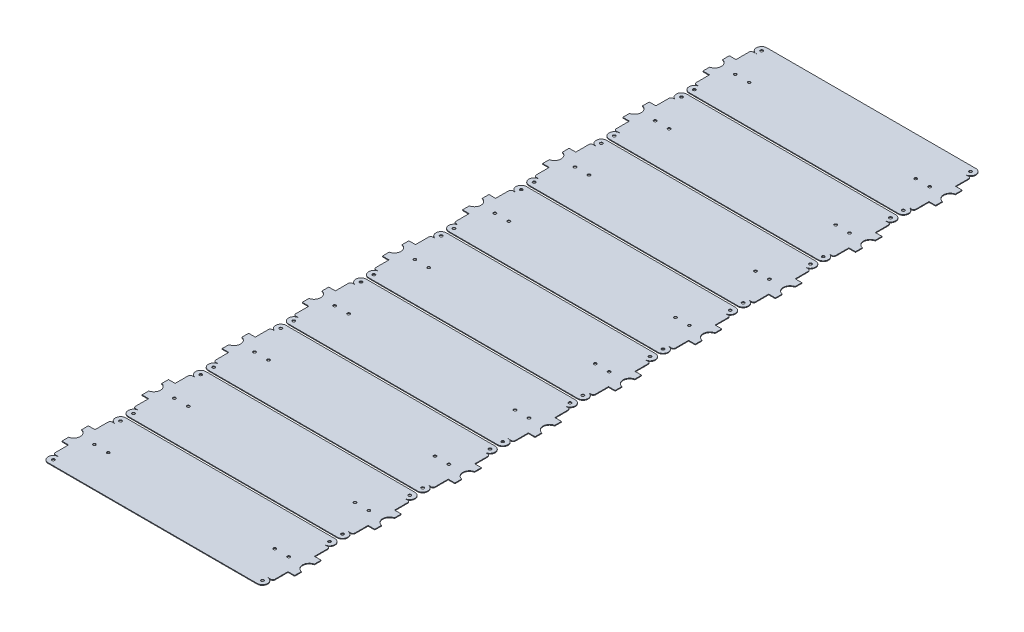
from build123d import *

# Parameters (mm, degrees)
SKETCH1_R           = 2
BOSS_EXTRUDE1_DEPTH = 1
LPATTERN1_COUNT     = 9
LPATTERN1_PITCH     = 115


with BuildPart() as part:
    # Sketch1 → Boss-Extrude1 (new body)
    with BuildSketch(Plane(origin=(0, 0, 0), x_dir=(1, 0, 0), z_dir=(0, 1, 0))):
        with BuildLine():
            ThreePointArc((150, 40.75), (157.5, 48.25), (150, 55.75))
            Line((150, 55.75), (-150, 55.75))
            ThreePointArc((-150, 55.75), (-157.5, 48.25), (-150, 40.75))
            Line((-150, 40.75), (-154.5, 40.75))
            ThreePointArc((-154.5, 40.75), (-156.621320344, 39.871320344), (-157.5, 37.75))
            Line((-157.5, 37.75), (-157.5, 19))
            Line((-157.5, 19), (-167.025, 19))
            Line((-167.025, 19), (-167.025, 9.312659395))
            ThreePointArc((-167.025, 9.312659395), (-159.5, 0), (-167.025, -9.312659395))
            Line((-167.025, -9.312659395), (-167.025, -19))
            Line((-167.025, -19), (-157.5, -19))
            Line((-157.5, -19), (-157.5, -37.75))
            ThreePointArc((-157.5, -37.75), (-156.621320344, -39.871320344), (-154.5, -40.75))
            Line((-154.5, -40.75), (-150, -40.75))
            ThreePointArc((-150, -40.75), (-157.5, -48.25), (-150, -55.75))
            Line((-150, -55.75), (150, -55.75))
            ThreePointArc((150, -55.75), (157.5, -48.25), (150, -40.75))
            Line((150, -40.75), (154.5, -40.75))
            ThreePointArc((154.5, -40.75), (156.621320344, -39.871320344), (157.5, -37.75))
            Line((157.5, -37.75), (157.5, -19))
            Line((157.5, -19), (167.025, -19))
            Line((167.025, -19), (167.025, -9.312659395))
            ThreePointArc((167.025, -9.312659395), (159.5, 0), (167.025, 9.312659395))
            Line((167.025, 9.312659395), (167.025, 19))
            Line((167.025, 19), (157.5, 19))
            Line((157.5, 19), (157.5, 37.75))
            ThreePointArc((157.5, 37.75), (156.621320344, 39.871320344), (154.5, 40.75))
            Line((154.5, 40.75), (150, 40.75))
        make_face()
        with Locations((-150, -48.25)):
            Circle(SKETCH1_R, mode=Mode.SUBTRACT)
        with Locations((150, -48.25)):
            Circle(SKETCH1_R, mode=Mode.SUBTRACT)
        with Locations((-139.5, 0)):
            Circle(SKETCH1_R, mode=Mode.SUBTRACT)
        with Locations((-119.5, 0)):
            Circle(SKETCH1_R, mode=Mode.SUBTRACT)
        with Locations((-150, 48.25)):
            Circle(SKETCH1_R, mode=Mode.SUBTRACT)
        with Locations((119.5, 0)):
            Circle(SKETCH1_R, mode=Mode.SUBTRACT)
        with Locations((139.5, 0)):
            Circle(SKETCH1_R, mode=Mode.SUBTRACT)
        with Locations((150, 48.25)):
            Circle(SKETCH1_R, mode=Mode.SUBTRACT)
    extrude(amount=BOSS_EXTRUDE1_DEPTH)


with BuildPart() as lpattern1_1:
    # LPattern1: pattern copy
    add(part.part.moved(Location(Vector(0, 0, -1) * (1 * LPATTERN1_PITCH))))


with BuildPart() as lpattern1_2:
    # LPattern1: pattern copy
    add(part.part.moved(Location(Vector(0, 0, -1) * (2 * LPATTERN1_PITCH))))


with BuildPart() as lpattern1_3:
    # LPattern1: pattern copy
    add(part.part.moved(Location(Vector(0, 0, -1) * (3 * LPATTERN1_PITCH))))


with BuildPart() as lpattern1_4:
    # LPattern1: pattern copy
    add(part.part.moved(Location(Vector(0, 0, -1) * (4 * LPATTERN1_PITCH))))


with BuildPart() as lpattern1_5:
    # LPattern1: pattern copy
    add(part.part.moved(Location(Vector(0, 0, -1) * (5 * LPATTERN1_PITCH))))


with BuildPart() as lpattern1_6:
    # LPattern1: pattern copy
    add(part.part.moved(Location(Vector(0, 0, -1) * (6 * LPATTERN1_PITCH))))


with BuildPart() as lpattern1_7:
    # LPattern1: pattern copy
    add(part.part.moved(Location(Vector(0, 0, -1) * (7 * LPATTERN1_PITCH))))


with BuildPart() as lpattern1_8:
    # LPattern1: pattern copy
    add(part.part.moved(Location(Vector(0, 0, -1) * (8 * LPATTERN1_PITCH))))


solid = Compound([part.part, lpattern1_1.part, lpattern1_2.part, lpattern1_3.part, lpattern1_4.part, lpattern1_5.part, lpattern1_6.part, lpattern1_7.part, lpattern1_8.part])
